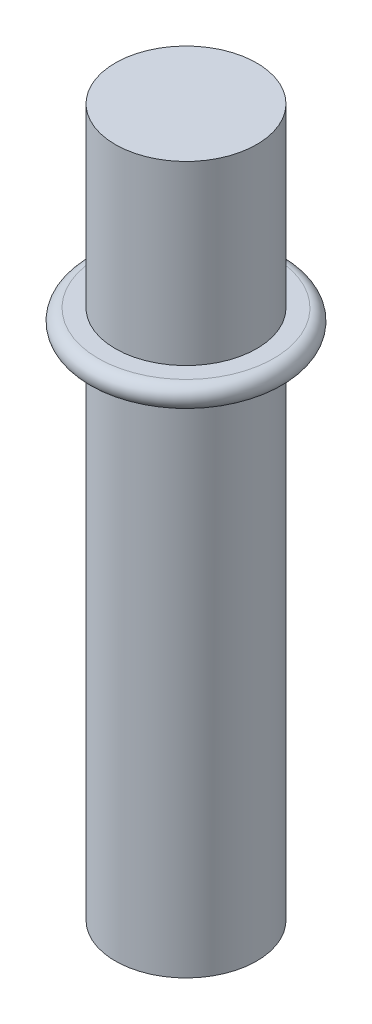
from build123d import *

# Parameters (mm, degrees)
SKETCH2_R           = 3.175
BOSS_EXTRUDE1_DEPTH = 14.859
SKETCH3_R           = 4.445
BOSS_EXTRUDE2_DEPTH = 1.016
FILLET2_R           = 0.508
SKETCH4_R           = 3.175
BOSS_EXTRUDE3_DEPTH = 7.9375
BOSS_EXTRUDE4_START = 7.9375
SKETCH5_R           = 3.175
BOSS_EXTRUDE4_DEPTH = 7.9375


with BuildPart() as part:
    # Sketch2 → Boss-Extrude1 (new body)
    with BuildSketch(Plane(origin=(0, 0, 0), x_dir=(1, 0, 0), z_dir=(0, 1, 0))):
        with Locations(Location((0, 0, 0), (0, 0, 270))):
            Circle(SKETCH2_R)
    extrude(amount=BOSS_EXTRUDE1_DEPTH)

    # Sketch5 → Boss-Extrude4 (add)
    with BuildSketch(Plane.XZ.offset(BOSS_EXTRUDE4_START)):
        with Locations(Location((0, 0, 0), (0, 0, 90))):
            Circle(SKETCH5_R)
    extrude(amount=-BOSS_EXTRUDE4_DEPTH)


with BuildPart() as body_2:
    # Sketch3 → Boss-Extrude2 (new body)
    with BuildSketch(Plane(origin=(0, 14.859, 0), x_dir=(1, 0, 0), z_dir=(0, 1, 0))):
        with Locations(Location((0, 0, 0), (0, 0, 270))):
            Circle(SKETCH3_R)
    extrude(amount=BOSS_EXTRUDE2_DEPTH)

    # Fillet2
    fillet2_edges = [body_2.edges().sort_by_distance(p)[0] for p in [
        (0, 14.859, -4.445),
        (0, 15.875, -4.445),
    ]]
    fillet(fillet2_edges, radius=FILLET2_R - 0.0001)  # a hair under: the kernel refuses the full size

    # Sketch4 → Boss-Extrude3 (add)
    with BuildSketch(Plane(origin=(0, 15.875, 0), x_dir=(1, 0, 0), z_dir=(0, 1, 0))):
        with Locations(Location((0, 0, 0), (0, 0, 270))):
            Circle(SKETCH4_R)
    extrude(amount=BOSS_EXTRUDE3_DEPTH)


solid = Compound([part.part, body_2.part])
